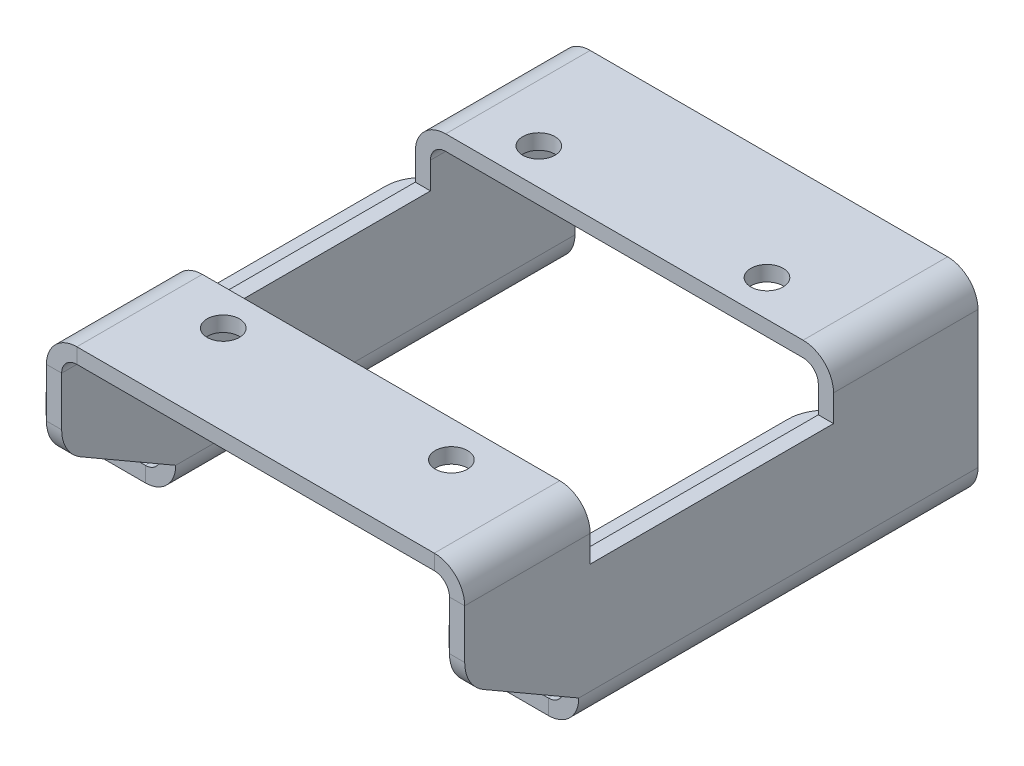
from build123d import *
from OCP.BRepFilletAPI import BRepFilletAPI_MakeChamfer

# Parameters (mm, degrees)
TABAN_FLAN_1_DEPTH      = 135
IZIM10_R                = 4.25
KES_EKSTR_ZYON1_DEPTH   = 10
IZIM11_W                = 140
IZIM11_H                = 64
KES_EKSTR_ZYON2_DEPTH   = 15
PAH1_SIZE               = 30
PAH1_SIZE2              = 17.320508076
KENAR_FLAN_1_DEPTH      = 105
KENAR_FLAN_1_BEND_DEPTH = 105
RADYUS1_R               = 10
IZIM18_R                = 4.5
KES_EKSTR_ZYON3_DEPTH   = 20
RADYUS2_R               = 10


# Sheet-metal steps are written as plain solids
with BuildPart() as part:
    # Çizim1 → Taban-Flanş1 (new body)
    with BuildSketch(Plane.XY):
        with BuildLine():
            Line((0, 0), (0, 36))
            ThreePointArc((0, 36), (2.343145751, 41.656854249), (8, 44))
            Line((8, 44), (102, 44))
            ThreePointArc((102, 44), (107.656854249, 41.656854249), (110, 36))
            Line((110, 36), (110, 0))
            Line((110, 0), (106, 0))
            Line((106, 0), (106, 36))
            ThreePointArc((106, 36), (104.828427125, 38.828427125), (102, 40))
            Line((102, 40), (8, 40))
            ThreePointArc((8, 40), (5.171572875, 38.828427125), (4, 36))
            Line((4, 36), (4, 0))
            Line((4, 0), (0, 0))
        make_face()
    extrude(amount=TABAN_FLAN_1_DEPTH)

    # Çizim10 → Kes-Ekstrüzyon1 (cut)
    with BuildSketch(Plane(origin=(0, 44, 0), x_dir=(1, 0, 0), z_dir=(0, 1, 0))):
        with Locations(Location((23, -111.5, 0), (0, 0, 270))):
            Circle(IZIM10_R)
        with Locations(Location((83, -111.5, 0), (0, 0, 270))):
            Circle(IZIM10_R)
        with Locations(Location((83, -28.5, 0), (0, 0, 270))):
            Circle(IZIM10_R)
        with Locations(Location((23, -28.5, 0), (0, 0, 270))):
            Circle(IZIM10_R)
    extrude(amount=-KES_EKSTR_ZYON1_DEPTH, mode=Mode.SUBTRACT)

    # Çizim11 → Kes-Ekstrüzyon2 (cut)
    with BuildSketch(Plane(origin=(0, 44, 0), x_dir=(1, 0, 0), z_dir=(0, 1, 0))):
        with Locations((55, -70)):
            Rectangle(IZIM11_W, IZIM11_H)
    extrude(amount=-KES_EKSTR_ZYON2_DEPTH, mode=Mode.SUBTRACT)

    # Pah1: one chamfer whose edges measure the first distance from different faces: ONE call of the kernel's chamfer builder (chamfer() names one face for all edges)
    pah1_edges_1 = [part.edges().sort_by_distance(p)[0] for p in [
        (2, 0, 135),
    ]]
    pah1_side_1 = [part.faces().sort_by_distance(p)[0] for p in [
        (2, 0, 67.5),
    ]]
    pah1_edges_2 = [part.edges().sort_by_distance(p)[0] for p in [
        (108, 0, 135),
    ]]
    pah1_side_2 = [part.faces().sort_by_distance(p)[0] for p in [
        (108, 0, 67.5),
    ]]
    pah1 = BRepFilletAPI_MakeChamfer(part.part.solid().wrapped)
    for e in pah1_edges_1:
        pah1.Add(PAH1_SIZE, PAH1_SIZE2, e.wrapped, pah1_side_1[0].wrapped)  # the first distance lies on this face
    for e in pah1_edges_2:
        pah1.Add(PAH1_SIZE, PAH1_SIZE2, e.wrapped, pah1_side_2[0].wrapped)  # the first distance lies on this face
    add(Compound.cast(pah1.Shape()), mode=Mode.REPLACE)

    # Kenar-Flanş1 section (across the edge) → Kenar-Flanş1 (add)
    with BuildSketch(Plane(origin=(0, -4, 0), x_dir=(0, 1, 0), z_dir=(0, 0, 1))):
        with BuildLine():
            Line((-4, 4), (-4, 36))
            Line((-4, 36), (0, 36))
            Line((0, 36), (0, 4))
            ThreePointArc((0, 4), (1.171572875, 1.171572875), (4, 0))
            Line((4, 0), (4, -4))
            ThreePointArc((4, -4), (-1.656854249, -1.656854249), (-4, 4))
        make_face()
    extrude(amount=KENAR_FLAN_1_DEPTH)

    # Kenar-Flanş1 section 2 (across the edge) → Kenar-Flanş1 bend (add)
    with BuildSketch(Plane(origin=(106, -4, 0), x_dir=(0, 1, 0), z_dir=(0, 0, 1))):
        with BuildLine():
            Line((-4, 4), (-4, 36))
            Line((-4, 36), (0, 36))
            Line((0, 36), (0, 4))
            ThreePointArc((0, 4), (1.171572875, 1.171572875), (4, 0))
            Line((4, 0), (4, -4))
            ThreePointArc((4, -4), (-1.656854249, -1.656854249), (-4, 4))
        make_face()
    extrude(amount=KENAR_FLAN_1_BEND_DEPTH)

    # Radyus1
    radyus1_edges = [part.edges().sort_by_distance(p)[0] for p in [
        (-36, -6, 0),
        (-36, -6, 105),
        (70, -6, 0),
        (70, -6, 105),
    ]]
    fillet(radyus1_edges, radius=RADYUS1_R)

    # Çizim18 → Kes-Ekstrüzyon3 (cut)
    with BuildSketch(Plane.XZ.offset(8)):
        with Locations((85, 80)):
            Circle(IZIM18_R)
        with Locations((85, 20)):
            Circle(IZIM18_R)
        with Locations((-21, 80)):
            Circle(IZIM18_R)
        with Locations((-21, 20)):
            Circle(IZIM18_R)
    extrude(amount=-KES_EKSTR_ZYON3_DEPTH, mode=Mode.SUBTRACT)

    # Radyus2
    radyus2_edges = [part.edges().sort_by_distance(p)[0] for p in [
        (108, 17.320508076, 135),
        (2, 17.320508076, 135),
    ]]
    fillet(radyus2_edges, radius=RADYUS2_R)


solid = part.part
